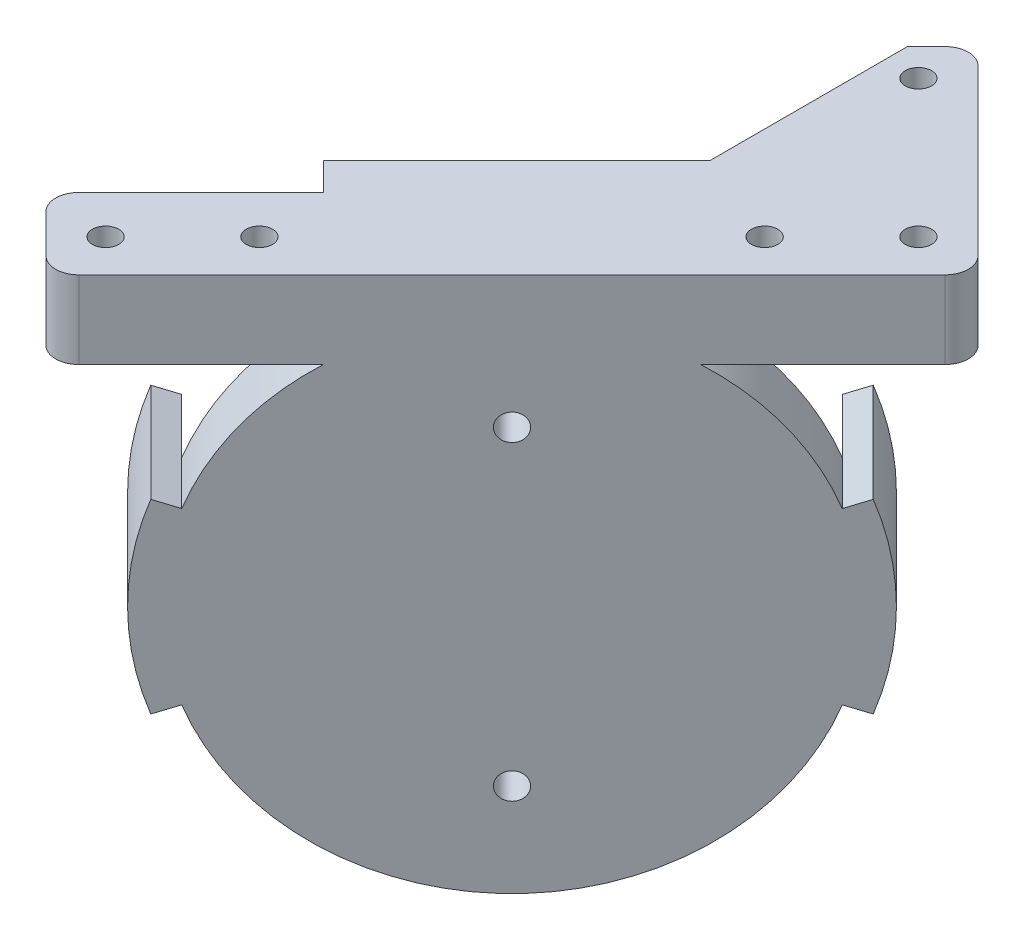
from build123d import *

# Parameters (mm, degrees)
SKETCH_1_R               = 1.25
EXTRUDE_1_DEPTH          = 3
SKETCH_2_R               = 1.5
CUT_EXTRUDE_1_DEPTH      = 3
CUT_EXTRUDE_2_DEPTH      = 3
CUT_EXTRUDE_3_DEPTH      = 3
CUT_EXTRUDE_4_DEPTH      = 10
SKETCH_6_R               = 1.5
CUT_EXTRUDE_5_DEPTH      = 10
SKETCH_7_R               = 1.5
CUT_EXTRUDE_8_DEPTH      = 10
SKETCH_8_R               = 1.5
CUT_EXTRUDE_9_DEPTH      = 10
SKETCH_9_R               = 15
CUT_EXTRUDE_10_DEPTH     = 10
SKETCH_11_R              = 1.5
EXTRUDE_3_DEPTH          = 3
CUT_EXTRUDE_12_DEPTH     = 3
EXTRUDE_4_DEPTH          = 3
SKETCH_15_R              = 15
EXTRUDE_5_DEPTH          = 3
CUT_EXTRUDE_13_DEPTH     = 3
EXTRUDE_START            = -3
EXTRUDE_7_DEPTH          = 3
CUT_EXTRUDE_14_DEPTH     = 3
CUT_EXTRUDE_15_DEPTH     = 3
PATTERN_CIRCULAR_1_COUNT = 8
SKETCH_22_R              = 1.25
CUT_EXTRUDE_17_DEPTH     = 3
SKETCH_23_R              = 1.5
CUT_EXTRUDE_18_DEPTH     = 10
SKETCH_24_R              = 1.5
CUT_EXTRUDE_19_DEPTH     = 10
CUT_EXTRUDE_START        = -10
SKETCH_25_R              = 60
CUT_EXTRUDE_20_DEPTH     = 10
EXTRUDE_8_DEPTH          = 3
EXTRUDE_10_DEPTH         = 3
SKETCH_28_R              = 1.54
SKETCH_28_R_2            = 1.52
SKETCH_28_R_3            = 1.5
CUT_EXTRUDE_21_DEPTH     = 3
SKETCH_29_R              = 1.5
CUT_EXTRUDE_22_DEPTH     = 3
EXTRUDE_11_DEPTH         = 3
SKETCH_31_R              = 1.5
CUT_EXTRUDE_23_DEPTH     = 3
EXTRUDE_12_DEPTH         = 3
CUT_EXTRUDE_24_DEPTH     = 3
EXTRUDE_13_DEPTH         = 3
CUT_EXTRUDE_25_DEPTH     = 10
CUT_EXTRUDE_26_DEPTH     = 10
EXTRUDE_14_DEPTH         = 3
SKETCH_38_R              = 6
CUT_EXTRUDE_28_DEPTH     = 3
SKETCH_39_R              = 1.5
CUT_EXTRUDE_29_DEPTH     = 3
CUT_EXTRUDE_30_DEPTH     = 10
SKETCH_41_R              = 1.7
EXTRUDE_15_DEPTH         = 10
SKETCH_42_W              = 84.852813742
SKETCH_42_H              = 3
CUT_EXTRUDE_31_DEPTH     = 48
CUT_EXTRUDE_33_DEPTH     = 10
SKETCH_45_R              = 1.7
EXTRUDE_16_DEPTH         = 8
CUT_EXTRUDE_START_2      = -19
SKETCH_46_R              = 1.7
CUT_EXTRUDE_34_DEPTH     = 19
FILLET_1_R               = 3
EXTRUDE_START_2          = 10
EXTRUDE_17_DEPTH         = 10


with BuildPart() as part:
    # 草图1 → 凸台-拉伸1 (new body)
    with BuildSketch(Plane(origin=(0, 0, 0), x_dir=(1, 0, 0), z_dir=(0, 1, 0))):
        with BuildLine():
            Line((-75, 15), (-75, -15))
            ThreePointArc((-75, -15), (-32.573593129, -32.573593129), (-15, -75))
            Line((-15, -75), (15, -75))
            ThreePointArc((15, -75), (32.573593129, -32.573593129), (75, -15))
            Line((75, -15), (75, 15))
            ThreePointArc((75, 15), (32.573593129, 32.573593129), (15, 75))
            Line((15, 75), (-15, 75))
            ThreePointArc((-15, 75), (-32.573593129, 32.573593129), (-75, 15))
        make_face()
        with Locations((-70, 11)):
            Circle(SKETCH_1_R, mode=Mode.SUBTRACT)
        with Locations((-11, 70)):
            Circle(SKETCH_1_R, mode=Mode.SUBTRACT)
        with Locations((-70, -11)):
            Circle(SKETCH_1_R, mode=Mode.SUBTRACT)
        with Locations((-11, -70)):
            Circle(SKETCH_1_R, mode=Mode.SUBTRACT)
        with Locations((11, 70)):
            Circle(SKETCH_1_R, mode=Mode.SUBTRACT)
        with Locations((70, 11)):
            Circle(SKETCH_1_R, mode=Mode.SUBTRACT)
        with Locations((70, -11)):
            Circle(SKETCH_1_R, mode=Mode.SUBTRACT)
        with Locations((11, -70)):
            Circle(SKETCH_1_R, mode=Mode.SUBTRACT)
    extrude(amount=EXTRUDE_1_DEPTH)

    # 草图2 → 切除-拉伸1 (cut)
    with BuildSketch(Plane.XZ):
        with Locations((0.353553391, -31.466251763)):
            Circle(SKETCH_2_R)
        with Locations((31.466251763, -0.353553391)):
            Circle(SKETCH_2_R)
        with Locations((-0.353553391, 31.466251763)):
            Circle(SKETCH_2_R)
        with Locations((-31.466251763, 0.353553391)):
            Circle(SKETCH_2_R)
    extrude(amount=-CUT_EXTRUDE_1_DEPTH, mode=Mode.SUBTRACT)

    # 草图3 → 切除-拉伸2 (cut)
    with BuildSketch(Plane(origin=(0, 3, 0), x_dir=(1, 0, 0), z_dir=(0, 1, 0))):
        Polygon((-12.02081528, 19.091883092), (-22.627416998, 22.627416998), (-19.091883092, 12.02081528), align=None)
    extrude(amount=-CUT_EXTRUDE_2_DEPTH, mode=Mode.SUBTRACT)

    # 草图4 → 切除-拉伸3 (cut)
    with BuildSketch(Plane(origin=(0, 3, 0), x_dir=(1, 0, 0), z_dir=(0, 1, 0))):
        with BuildLine():
            ThreePointArc((33.944668714, -19.80253309), (34.043922781, -8.582763971), (22.827665534, -8.285032838))
            Line((22.827665534, -8.285032838), (15.556349186, -15.556349186))
            Line((15.556349186, -15.556349186), (8.285032838, -22.827665534))
            ThreePointArc((8.285032838, -22.827665534), (8.582763971, -34.043922781), (19.80253309, -33.944668714))
            Line((19.80253309, -33.944668714), (33.944668714, -19.80253309))
        make_face()
    extrude(amount=-CUT_EXTRUDE_3_DEPTH, mode=Mode.SUBTRACT)

    # 草图5 → 切除-拉伸4 (cut)
    with BuildSketch(Plane(origin=(0, 3, 0), x_dir=(1, 0, 0), z_dir=(0, 1, 0))):
        Polygon((-22.627416998, 22.627416998), (-12.02081528, 19.091883092), (-8.485281374, 22.627416998), align=None)
        Polygon((-19.091883092, 12.02081528), (-22.627416998, 22.627416998), (-22.627416998, 8.485281374), align=None)
    extrude(amount=-CUT_EXTRUDE_4_DEPTH, mode=Mode.SUBTRACT)

    # 草图6 → 切除-拉伸5 (cut)
    with BuildSketch(Plane(origin=(0, 3, 0), x_dir=(1, 0, 0), z_dir=(0, 1, 0))):
        with Locations((-35.355339059, -21.213203436)):
            Circle(SKETCH_6_R)
        with Locations((-21.213203436, -35.355339059)):
            Circle(SKETCH_6_R)
        with Locations((35.355339059, 21.213203436)):
            Circle(SKETCH_6_R)
        with Locations((21.213203436, 35.355339059)):
            Circle(SKETCH_6_R)
    extrude(amount=-CUT_EXTRUDE_5_DEPTH, mode=Mode.SUBTRACT)

    # 草图7 → 切除-拉伸8 (cut)
    with BuildSketch(Plane(origin=(0, 3, 0), x_dir=(1, 0, 0), z_dir=(0, 1, 0))):
        with Locations((-29.69848481, 29.69848481)):
            Circle(SKETCH_7_R)
        with Locations((29.69848481, 29.69848481)):
            Circle(SKETCH_7_R)
        with Locations((29.69848481, -29.69848481)):
            Circle(SKETCH_7_R)
        with Locations((-29.69848481, -29.69848481)):
            Circle(SKETCH_7_R)
    extrude(amount=-CUT_EXTRUDE_8_DEPTH, mode=Mode.SUBTRACT)

    # 草图8 → 切除-拉伸9 (cut)
    with BuildSketch(Plane(origin=(0, 3, 0), x_dir=(1, 0, 0), z_dir=(0, 1, 0))):
        with Locations((-11, 55)):
            Circle(SKETCH_8_R)
        with Locations((11, 55)):
            Circle(SKETCH_8_R)
        with Locations((55, 11)):
            Circle(SKETCH_8_R)
        with Locations((55, -11)):
            Circle(SKETCH_8_R)
        with Locations((11, -55)):
            Circle(SKETCH_8_R)
        with Locations((-11, -55)):
            Circle(SKETCH_8_R)
        with Locations((-55, -11)):
            Circle(SKETCH_8_R)
        with Locations((-55, 11)):
            Circle(SKETCH_8_R)
    extrude(amount=-CUT_EXTRUDE_9_DEPTH, mode=Mode.SUBTRACT)

    # 草图9 → 切除-拉伸10 (cut)
    with BuildSketch(Plane(origin=(0, 3, 0), x_dir=(1, 0, 0), z_dir=(0, 1, 0))):
        Circle(SKETCH_9_R)
    extrude(amount=-CUT_EXTRUDE_10_DEPTH, mode=Mode.SUBTRACT)

    # 草图11 → 凸台-拉伸3 (add)
    with BuildSketch(Plane(origin=(0, 3, 0), x_dir=(1, 0, 0), z_dir=(0, 1, 0))):
        with Locations((-35.355339059, -21.213203436)):
            Circle(SKETCH_11_R)
        with Locations((35.355339059, 21.213203436)):
            Circle(SKETCH_11_R)
        with Locations((21.213203436, 35.355339059)):
            Circle(SKETCH_11_R)
        with Locations((0.353553391, 31.466251763)):
            Circle(SKETCH_11_R)
        with Locations((31.466251763, 0.353553391)):
            Circle(SKETCH_11_R)
        with Locations((-0.353553391, -31.466251763)):
            Circle(SKETCH_11_R)
        with Locations((-31.466251763, -0.353553391)):
            Circle(SKETCH_11_R)
        with Locations((-21.213203436, -35.355339059)):
            Circle(SKETCH_11_R)
    extrude(amount=-EXTRUDE_3_DEPTH)

    # 草图12 → 切除-拉伸12 (cut)
    with BuildSketch(Plane(origin=(0, 3, 0), x_dir=(1, 0, 0), z_dir=(0, 1, 0))):
        with BuildLine():
            Line((-44, 10), (-44, -10))
            ThreePointArc((-44, -10), (-40, -14), (-36, -10))
            Line((-36, -10), (-36, 0))
            Line((-36, 0), (-36, 10))
            ThreePointArc((-36, 10), (-40, 14), (-44, 10))
        make_face()
        with BuildLine():
            Line((10, 44), (-10, 44))
            ThreePointArc((-10, 44), (-14, 40), (-10, 36))
            Line((-10, 36), (10, 36))
            ThreePointArc((10, 36), (14, 40), (10, 44))
        make_face()
        with BuildLine():
            Line((44, -10), (44, 10))
            ThreePointArc((44, 10), (40, 14), (36, 10))
            Line((36, 10), (36, -10))
            ThreePointArc((36, -10), (40, -14), (44, -10))
        make_face()
        with BuildLine():
            Line((-10, -44), (10, -44))
            ThreePointArc((10, -44), (14, -40), (10, -36))
            Line((10, -36), (-10, -36))
            ThreePointArc((-10, -36), (-14, -40), (-10, -44))
        make_face()
    extrude(amount=-CUT_EXTRUDE_12_DEPTH, mode=Mode.SUBTRACT)

    # 草图14 → 凸台-拉伸4 (add)
    with BuildSketch(Plane(origin=(0, 3, 0), x_dir=(1, 0, 0), z_dir=(0, 1, 0))):
        with BuildLine():
            ThreePointArc((8.285032838, -22.827665534), (8.582763971, -34.043922781), (19.80253309, -33.944668714))
            Line((19.80253309, -33.944668714), (33.944668714, -19.80253309))
            ThreePointArc((33.944668714, -19.80253309), (34.043922781, -8.582763971), (22.827665534, -8.285032838))
            Line((22.827665534, -8.285032838), (8.285032838, -22.827665534))
        make_face()
    extrude(amount=-EXTRUDE_4_DEPTH)

    # 草图15 → 凸台-拉伸5 (add)
    with BuildSketch(Plane(origin=(0, 3, 0), x_dir=(1, 0, 0), z_dir=(0, 1, 0))):
        Circle(SKETCH_15_R)
    extrude(amount=-EXTRUDE_5_DEPTH)

    # 草图17 → 切除-拉伸13 (cut)
    with BuildSketch(Plane(origin=(0, 3, 0), x_dir=(1, 0, 0), z_dir=(0, 1, 0))):
        with BuildLine():
            Line((-2, -20), (-2, -10))
            ThreePointArc((-2, -10), (0, -8), (2, -10))
            Line((2, -10), (2, -20))
            ThreePointArc((2, -20), (0, -22), (-2, -20))
        make_face()
        with BuildLine():
            Line((-20, 2), (-10, 2))
            ThreePointArc((-10, 2), (-8, 0), (-10, -2))
            Line((-10, -2), (-20, -2))
            ThreePointArc((-20, -2), (-22, 0), (-20, 2))
        make_face()
        with BuildLine():
            Line((2, 20), (2, 10))
            ThreePointArc((2, 10), (0, 8), (-2, 10))
            Line((-2, 10), (-2, 20))
            ThreePointArc((-2, 20), (0, 22), (2, 20))
        make_face()
        with BuildLine():
            Line((20, -2), (10, -2))
            ThreePointArc((10, -2), (8, 0), (10, 2))
            Line((10, 2), (20, 2))
            ThreePointArc((20, 2), (22, 0), (20, -2))
        make_face()
    extrude(amount=-CUT_EXTRUDE_13_DEPTH, mode=Mode.SUBTRACT)

    # 草图18 → 凸台-拉伸7 (add)
    with BuildSketch(Plane(origin=(0, 3, 0), x_dir=(1, 0, 0), z_dir=(0, 1, 0)).offset(EXTRUDE_START)):
        with BuildLine():
            ThreePointArc((-45.952273324, 22.500194525), (-32.573593129, 32.573593129), (-22.500194525, 45.952273324))
            Line((-22.500194525, 45.952273324), (-38.525223259, 61.977302058))
            ThreePointArc((-38.525223259, 61.977302058), (-89.142135624, 89.142135624), (-61.977302058, 38.525223259))
            Line((-61.977302058, 38.525223259), (-45.952273324, 22.500194525))
        make_face()
    extrude(amount=EXTRUDE_7_DEPTH)

    # 草图19 → 切除-拉伸14 (cut)
    with BuildSketch(Plane(origin=(0, 3, 0), x_dir=(1, 0, 0), z_dir=(0, 1, 0))):
        with BuildLine():
            ThreePointArc((-37.140781925, 51.282917549), (-43.180194847, 43.180194847), (-51.282917549, 37.140781925))
            Line((-51.282917549, 37.140781925), (-43.975815885, 29.833680261))
            ThreePointArc((-43.975815885, 29.833680261), (-36.109127035, 36.109127035), (-29.833680261, 43.975815885))
            Line((-29.833680261, 43.975815885), (-37.140781925, 51.282917549))
        make_face()
    extrude(amount=-CUT_EXTRUDE_14_DEPTH, mode=Mode.SUBTRACT)

    # 草图21 → 切除-拉伸15 (cut)
    with BuildSketch(Plane(origin=(0, 3, 0), x_dir=(1, 0, 0), z_dir=(0, 1, 0))):
        with BuildLine():
            ThreePointArc((-59.9739809, 61.741747853), (-60.857864376, 62.107864376), (-61.741747853, 61.741747853))
            ThreePointArc((-61.741747853, 61.741747853), (-62.107864376, 60.857864376), (-61.741747853, 59.9739809))
            Line((-61.741747853, 59.9739809), (-54.670680041, 52.902913088))
            ThreePointArc((-54.670680041, 52.902913088), (-52.902913088, 52.902913088), (-52.902913088, 54.670680041))
            Line((-52.902913088, 54.670680041), (-59.9739809, 61.741747853))
        make_face()
        with BuildLine():
            ThreePointArc((-75.883883476, 74.116116524), (-75, 73.75), (-74.116116524, 74.116116524))
            ThreePointArc((-74.116116524, 74.116116524), (-73.75, 75), (-74.116116524, 75.883883476))
            Line((-74.116116524, 75.883883476), (-81.187184335, 82.954951288))
            ThreePointArc((-81.187184335, 82.954951288), (-82.954951288, 82.954951288), (-82.954951288, 81.187184335))
            Line((-82.954951288, 81.187184335), (-75.883883476, 74.116116524))
        make_face()
    cut_extrude_15 = extrude(amount=-CUT_EXTRUDE_15_DEPTH, mode=Mode.SUBTRACT)

    # 阵列(圆周)1: 切除-拉伸15 ×8 about axis
    pattern_circular_1_axis = Axis((-67.928932188, 3, -67.928932188), (0, 1, 0))
    for i in range(1, PATTERN_CIRCULAR_1_COUNT):
        add(cut_extrude_15.rotate(pattern_circular_1_axis, i * 360 / PATTERN_CIRCULAR_1_COUNT), mode=Mode.SUBTRACT)

    # 草图22 → 切除-拉伸17 (cut)
    with BuildSketch(Plane(origin=(0, 3, 0), x_dir=(1, 0, 0), z_dir=(0, 1, 0))):
        with Locations((9.899494937, 9.899494937)):
            Circle(SKETCH_22_R)
        with Locations((-9.899494937, -9.899494937)):
            Circle(SKETCH_22_R)
    extrude(amount=-CUT_EXTRUDE_17_DEPTH, mode=Mode.SUBTRACT)

    # 草图23 → 切除-拉伸18 (cut)
    with BuildSketch(Plane(origin=(0, 3, 0), x_dir=(1, 0, 0), z_dir=(0, 1, 0))):
        with Locations((0, 30)):
            Circle(SKETCH_23_R)
        with Locations((30, 0)):
            Circle(SKETCH_23_R)
        with Locations((0, -30)):
            Circle(SKETCH_23_R)
        with Locations((-30, 0)):
            Circle(SKETCH_23_R)
    extrude(amount=-CUT_EXTRUDE_18_DEPTH, mode=Mode.SUBTRACT)

    # 草图24 → 切除-拉伸19 (cut)
    with BuildSketch(Plane(origin=(0, 3, 0), x_dir=(1, 0, 0), z_dir=(0, 1, 0))):
        with Locations((-15, -15)):
            Circle(SKETCH_24_R)
        with Locations((15, 15)):
            Circle(SKETCH_24_R)
    extrude(amount=-CUT_EXTRUDE_19_DEPTH, mode=Mode.SUBTRACT)

    # 草图25 → 切除-拉伸20 (cut)
    with BuildSketch(Plane(origin=(0, 3, 0), x_dir=(1, 0, 0), z_dir=(0, 1, 0)).offset(CUT_EXTRUDE_START)):
        with Locations((-75, 75)):
            Circle(SKETCH_25_R)
    extrude(amount=CUT_EXTRUDE_20_DEPTH, mode=Mode.SUBTRACT)

    # 草图26 → 凸台-拉伸8 (add)
    with BuildSketch(Plane(origin=(0, 3, 0), x_dir=(1, 0, 0), z_dir=(0, 1, 0)).offset(EXTRUDE_START)):
        with BuildLine():
            ThreePointArc((-75, 15), (-32.573593129, 32.573593129), (-15, 75))
            Line((-15, 75), (-75, 15))
        make_face()
    extrude(amount=EXTRUDE_8_DEPTH)

    # 草图27 → 凸台-拉伸10 (add)
    with BuildSketch(Plane.XZ):
        Polygon((-75, -15), (-89.142135624, -29.142135624), (-29.142135624, -89.142135624), (-15, -75), align=None)
    extrude(amount=-EXTRUDE_10_DEPTH)

    # 草图28 → 切除-拉伸21 (cut)
    with BuildSketch(Plane.XZ):
        with Locations((-25.908116908, -78.234018716)):
            Circle(SKETCH_28_R)
        with Locations((-78.234018716, -25.908116908)):
            Circle(SKETCH_28_R_2)
        with Locations((11, -70)):
            Circle(SKETCH_28_R_3)
        with Locations((-11, -70)):
            Circle(SKETCH_28_R_3)
        with Locations((-70, -11)):
            Circle(SKETCH_28_R_3)
        with Locations((-70, 11)):
            Circle(SKETCH_28_R_3)
        with Locations((-11, 70)):
            Circle(SKETCH_28_R_3)
        with Locations((11, 70)):
            Circle(SKETCH_28_R_3)
        with Locations((70, 11)):
            Circle(SKETCH_28_R_3)
        with Locations((70, -11)):
            Circle(SKETCH_28_R_3)
    extrude(amount=-CUT_EXTRUDE_21_DEPTH, mode=Mode.SUBTRACT)

    # 草图29 → 切除-拉伸22 (cut)
    with BuildSketch(Plane.XZ):
        with Locations((-68.334523779, -35.807611845)):
            Circle(SKETCH_29_R)
        with Locations((-35.807611845, -68.334523779)):
            Circle(SKETCH_29_R)
    extrude(amount=-CUT_EXTRUDE_22_DEPTH, mode=Mode.SUBTRACT)

    # 草图30 → 凸台-拉伸11 (add)
    with BuildSketch(Plane.XZ):
        Polygon((-29.142135624, -89.142135624), (-89.142135624, -29.142135624), (-103.284271247, -43.284271247), (-43.284271247, -103.284271247), align=None)
    extrude(amount=-EXTRUDE_11_DEPTH)

    # 草图31 → 切除-拉伸23 (cut)
    with BuildSketch(Plane.XZ):
        with Locations((-43.585786438, -95.911688245)):
            Circle(SKETCH_31_R)
        with Locations((-53.485281374, -86.012193309)):
            Circle(SKETCH_31_R)
        with Locations((-86.012193309, -53.485281374)):
            Circle(SKETCH_31_R)
        with Locations((-95.911688245, -43.585786438)):
            Circle(SKETCH_31_R)
    extrude(amount=-CUT_EXTRUDE_23_DEPTH, mode=Mode.SUBTRACT)

    # 草图32 → 凸台-拉伸12 (add)
    with BuildSketch(Plane.XZ):
        with BuildLine():
            ThreePointArc((15, 75), (32.573593129, 32.573593129), (75, 15))
            Line((75, 15), (89.142135624, 29.142135624))
            Line((89.142135624, 29.142135624), (29.142135624, 89.142135624))
            Line((29.142135624, 89.142135624), (15, 75))
        make_face()
    extrude(amount=-EXTRUDE_12_DEPTH)

    # 草图33 → 切除-拉伸24 (cut)
    with BuildSketch(Plane(origin=(0, 0, 0), x_dir=(-1, 0, 0), z_dir=(0, -1, 0))):
        with BuildLine():
            Line((-29.554853575, -42.91995823), (-19.554853575, -42.91995823))
            ThreePointArc((-19.554853575, -42.91995823), (-18.054501588, -44.420310217), (-19.554853575, -45.920662203))
            Line((-19.554853575, -45.920662203), (-29.554853575, -45.920662203))
            ThreePointArc((-29.554853575, -45.920662203), (-31.055205561, -44.420310217), (-29.554853575, -42.91995823))
        make_face()
        with BuildLine():
            Line((-42.91995823, -59.285766859), (-42.91995823, -69.285766859))
            ThreePointArc((-42.91995823, -69.285766859), (-44.420310217, -70.786118845), (-45.920662203, -69.285766859))
            Line((-45.920662203, -69.285766859), (-45.920662203, -59.285766859))
            ThreePointArc((-45.920662203, -59.285766859), (-44.420310217, -57.785414872), (-42.91995823, -59.285766859))
        make_face()
        with BuildLine():
            Line((-59.285766859, -45.920662203), (-69.285766859, -45.920662203))
            ThreePointArc((-69.285766859, -45.920662203), (-70.786118845, -44.420310217), (-69.285766859, -42.91995823))
            Line((-69.285766859, -42.91995823), (-59.285766859, -42.91995823))
            ThreePointArc((-59.285766859, -42.91995823), (-57.785414872, -44.420310217), (-59.285766859, -45.920662203))
        make_face()
        with BuildLine():
            Line((-45.920662203, -29.554853575), (-45.920662203, -19.554853575))
            ThreePointArc((-45.920662203, -19.554853575), (-44.420310217, -18.054501588), (-42.91995823, -19.554853575))
            Line((-42.91995823, -19.554853575), (-42.91995823, -29.554853575))
            ThreePointArc((-42.91995823, -29.554853575), (-44.420310217, -31.055205561), (-45.920662203, -29.554853575))
        make_face()
    extrude(amount=-CUT_EXTRUDE_24_DEPTH, mode=Mode.SUBTRACT)

    # 草图34 → 凸台-拉伸13 (add)
    with BuildSketch(Plane.XZ):
        Polygon((29.142135624, 89.142135624), (89.142135624, 29.142135624), (103.284271247, 43.284271247), (43.284271247, 103.284271247), align=None)
    extrude(amount=-EXTRUDE_13_DEPTH)

    # 草图35 → 切除-拉伸25 (cut)
    with BuildSketch(Plane.XZ.offset(CUT_EXTRUDE_START)):
        with BuildLine():
            Line((18.485281374, 37.171572875), (12.828427125, 42.828427125))
            ThreePointArc((12.828427125, 42.828427125), (7.171572875, 42.828427125), (7.171572875, 37.171572875))
            Line((7.171572875, 37.171572875), (12.828427125, 31.514718626))
            ThreePointArc((12.828427125, 31.514718626), (18.485281374, 31.514718626), (18.485281374, 37.171572875))
        make_face()
        with BuildLine():
            Line((-12.828427125, 31.514718626), (-7.171572875, 37.171572875))
            ThreePointArc((-7.171572875, 37.171572875), (-7.171572875, 42.828427125), (-12.828427125, 42.828427125))
            Line((-12.828427125, 42.828427125), (-18.485281374, 37.171572875))
            ThreePointArc((-18.485281374, 37.171572875), (-18.485281374, 31.514718626), (-12.828427125, 31.514718626))
        make_face()
        with BuildLine():
            Line((37.171572875, -18.485281374), (42.828427125, -12.828427125))
            ThreePointArc((42.828427125, -12.828427125), (42.828427125, -7.171572875), (37.171572875, -7.171572875))
            Line((37.171572875, -7.171572875), (31.514718626, -12.828427125))
            ThreePointArc((31.514718626, -12.828427125), (31.514718626, -18.485281374), (37.171572875, -18.485281374))
        make_face()
        with BuildLine():
            Line((31.514718626, 12.828427125), (37.171572875, 7.171572875))
            ThreePointArc((37.171572875, 7.171572875), (42.828427125, 7.171572875), (42.828427125, 12.828427125))
            Line((42.828427125, 12.828427125), (37.171572875, 18.485281374))
            ThreePointArc((37.171572875, 18.485281374), (31.514718626, 18.485281374), (31.514718626, 12.828427125))
        make_face()
        with BuildLine():
            Line((-18.485281374, -37.171572875), (-12.828427125, -42.828427125))
            ThreePointArc((-12.828427125, -42.828427125), (-7.171572875, -42.828427125), (-7.171572875, -37.171572875))
            Line((-7.171572875, -37.171572875), (-12.828427125, -31.514718626))
            ThreePointArc((-12.828427125, -31.514718626), (-18.485281374, -31.514718626), (-18.485281374, -37.171572875))
        make_face()
        with BuildLine():
            Line((12.828427125, -31.514718626), (7.171572875, -37.171572875))
            ThreePointArc((7.171572875, -37.171572875), (7.171572875, -42.828427125), (12.828427125, -42.828427125))
            Line((12.828427125, -42.828427125), (18.485281374, -37.171572875))
            ThreePointArc((18.485281374, -37.171572875), (18.485281374, -31.514718626), (12.828427125, -31.514718626))
        make_face()
        with BuildLine():
            Line((-37.171572875, 18.485281374), (-42.828427125, 12.828427125))
            ThreePointArc((-42.828427125, 12.828427125), (-42.828427125, 7.171572875), (-37.171572875, 7.171572875))
            Line((-37.171572875, 7.171572875), (-31.514718626, 12.828427125))
            ThreePointArc((-31.514718626, 12.828427125), (-31.514718626, 18.485281374), (-37.171572875, 18.485281374))
        make_face()
        with BuildLine():
            Line((-31.514718626, -12.828427125), (-37.171572875, -7.171572875))
            ThreePointArc((-37.171572875, -7.171572875), (-42.828427125, -7.171572875), (-42.828427125, -12.828427125))
            Line((-42.828427125, -12.828427125), (-37.171572875, -18.485281374))
            ThreePointArc((-37.171572875, -18.485281374), (-31.514718626, -18.485281374), (-31.514718626, -12.828427125))
        make_face()
    extrude(amount=CUT_EXTRUDE_25_DEPTH, mode=Mode.SUBTRACT)

    # 草图36 → 切除-拉伸26 (cut)
    with BuildSketch(Plane.XZ):
        with BuildLine():
            Line((19.554853575, 45.920310217), (29.554853575, 45.920310217))
            ThreePointArc((29.554853575, 45.920310217), (31.054853575, 44.420310217), (29.554853575, 42.920310217))
            Line((29.554853575, 42.920310217), (19.554853575, 42.920310217))
            ThreePointArc((19.554853575, 42.920310217), (18.054853575, 44.420310217), (19.554853575, 45.920310217))
        make_face()
        with BuildLine():
            Line((45.920310217, 69.285766859), (45.920310217, 59.285766859))
            ThreePointArc((45.920310217, 59.285766859), (44.420310217, 57.785766859), (42.920310217, 59.285766859))
            Line((42.920310217, 59.285766859), (42.920310217, 69.285766859))
            ThreePointArc((42.920310217, 69.285766859), (44.420310217, 70.785766859), (45.920310217, 69.285766859))
        make_face()
        with BuildLine():
            Line((69.285766859, 42.920310217), (59.285766859, 42.920310217))
            ThreePointArc((59.285766859, 42.920310217), (57.785766859, 44.420310217), (59.285766859, 45.920310217))
            Line((59.285766859, 45.920310217), (69.285766859, 45.920310217))
            ThreePointArc((69.285766859, 45.920310217), (70.785766859, 44.420310217), (69.285766859, 42.920310217))
        make_face()
        with BuildLine():
            Line((42.920310217, 19.554853575), (42.920310217, 29.554853575))
            ThreePointArc((42.920310217, 29.554853575), (44.420310217, 31.054853575), (45.920310217, 29.554853575))
            Line((45.920310217, 29.554853575), (45.920310217, 19.554853575))
            ThreePointArc((45.920310217, 19.554853575), (44.420310217, 18.054853575), (42.920310217, 19.554853575))
        make_face()
        with BuildLine():
            Line((26.625921387, 52.991378029), (36.625921387, 52.991378029))
            ThreePointArc((36.625921387, 52.991378029), (38.125921387, 51.491378029), (36.625921387, 49.991378029))
            Line((36.625921387, 49.991378029), (26.625921387, 49.991378029))
            ThreePointArc((26.625921387, 49.991378029), (25.125921387, 51.491378029), (26.625921387, 52.991378029))
        make_face()
        with BuildLine():
            Line((52.991378029, 76.356834671), (52.991378029, 66.356834671))
            ThreePointArc((52.991378029, 66.356834671), (51.491378029, 64.856834671), (49.991378029, 66.356834671))
            Line((49.991378029, 66.356834671), (49.991378029, 76.356834671))
            ThreePointArc((49.991378029, 76.356834671), (51.491378029, 77.856834671), (52.991378029, 76.356834671))
        make_face()
        with BuildLine():
            Line((76.356834671, 49.991378029), (66.356834671, 49.991378029))
            ThreePointArc((66.356834671, 49.991378029), (64.856834671, 51.491378029), (66.356834671, 52.991378029))
            Line((66.356834671, 52.991378029), (76.356834671, 52.991378029))
            ThreePointArc((76.356834671, 52.991378029), (77.856834671, 51.491378029), (76.356834671, 49.991378029))
        make_face()
        with BuildLine():
            Line((49.991378029, 26.625921387), (49.991378029, 36.625921387))
            ThreePointArc((49.991378029, 36.625921387), (51.491378029, 38.125921387), (52.991378029, 36.625921387))
            Line((52.991378029, 36.625921387), (52.991378029, 26.625921387))
            ThreePointArc((52.991378029, 26.625921387), (51.491378029, 25.125921387), (49.991378029, 26.625921387))
        make_face()
    extrude(amount=-CUT_EXTRUDE_26_DEPTH, mode=Mode.SUBTRACT)

    # 草图37 → 凸台-拉伸14 (add)
    with BuildSketch(Plane.XZ):
        with BuildLine():
            Line((47.887960234, 69.285766859), (47.887960234, 59.853486281))
            ThreePointArc((47.887960234, 59.853486281), (44.420310217, 56.385836264), (40.9526602, 59.853486281))
            Line((40.9526602, 59.853486281), (40.9526602, 69.285766859))
            ThreePointArc((40.9526602, 69.285766859), (44.420310217, 72.753416876), (47.887960234, 69.285766859))
        make_face()
        with BuildLine():
            Line((60.034978693, 48.181382834), (68.503147508, 48.181382834))
            ThreePointArc((68.503147508, 48.181382834), (71.914895036, 44.769635306), (68.503147508, 41.357887778))
            Line((68.503147508, 41.357887778), (60.034978693, 41.357887778))
            ThreePointArc((60.034978693, 41.357887778), (56.623231165, 44.769635306), (60.034978693, 48.181382834))
        make_face()
        with BuildLine():
            Line((48.512210879, 29.554853575), (48.512210879, 19.628947818))
            ThreePointArc((48.512210879, 19.628947818), (44.420310217, 15.537047156), (40.328409554, 19.628947818))
            Line((40.328409554, 19.628947818), (40.328409554, 29.554853575))
            ThreePointArc((40.328409554, 29.554853575), (44.420310217, 33.646754237), (48.512210879, 29.554853575))
        make_face()
        with BuildLine():
            Line((20.324066568, 48.08525583), (29.519488245, 48.08525583))
            ThreePointArc((29.519488245, 48.08525583), (32.835108769, 44.769635306), (29.519488245, 41.454014782))
            Line((29.519488245, 41.454014782), (20.324066568, 41.454014782))
            ThreePointArc((20.324066568, 41.454014782), (17.008446044, 44.769635306), (20.324066568, 48.08525583))
        make_face()
    extrude(amount=-EXTRUDE_14_DEPTH)

    # 草图38 → 切除-拉伸28 (cut)
    with BuildSketch(Plane.XZ):
        with Locations((51.491378029, 51.491378029)):
            Circle(SKETCH_38_R)
        with Locations((-58.110173055, -58.110173055)):
            Circle(SKETCH_38_R)
        Polygon((-52.453318806, -52.453318806), (-53.867532368, -51.039105243), (-51.039105243, -51.039105243), (-51.039105243, -53.867532368), align=None)
        Polygon((57.148232278, 57.148232278), (55.734018716, 58.562445841), (58.562445841, 58.562445841), (58.562445841, 55.734018716), align=None)
        Polygon((59.491378029, 53.491378029), (61.491378029, 51.491378029), (59.491378029, 49.491378029), (59.491378029, 51.491378029), align=None)
        Polygon((58.562445841, 47.248737342), (58.562445841, 44.420310217), (55.734018716, 44.420310217), (57.148232278, 45.834523779), align=None)
        Polygon((53.491378029, 43.491378029), (51.491378029, 41.491378029), (49.491378029, 43.491378029), (51.491378029, 43.491378029), align=None)
        Polygon((47.248737342, 44.420310217), (44.420310217, 44.420310217), (44.420310217, 47.248737342), (45.834523779, 45.834523779), align=None)
        Polygon((43.491378029, 49.491378029), (41.491378029, 51.491378029), (43.491378029, 53.491378029), (43.491378029, 51.491378029), align=None)
        Polygon((44.420310217, 55.734018716), (44.420310217, 58.562445841), (47.248737342, 58.562445841), (45.834523779, 57.148232278), align=None)
        Polygon((49.491378029, 59.491378029), (51.491378029, 61.491378029), (53.491378029, 59.491378029), (51.491378029, 59.491378029), align=None)
        Polygon((-50.110173055, -56.110173055), (-48.110173055, -58.110173055), (-50.110173055, -60.110173055), (-50.110173055, -58.110173055), align=None)
        Polygon((-51.039105243, -62.352813742), (-51.039105243, -65.181240867), (-53.867532368, -65.181240867), (-52.453318806, -63.767027305), align=None)
        Polygon((-56.110173055, -66.110173055), (-58.110173055, -68.110173055), (-60.110173055, -66.110173055), (-58.110173055, -66.110173055), align=None)
        Polygon((-62.352813742, -65.181240867), (-65.181240867, -65.181240867), (-65.181240867, -62.352813742), (-63.767027305, -63.767027305), align=None)
        Polygon((-66.110173055, -60.110173055), (-68.110173055, -58.110173055), (-66.110173055, -56.110173055), (-66.110173055, -58.110173055), align=None)
        Polygon((-65.181240867, -53.867532368), (-65.181240867, -51.039105243), (-62.352813742, -51.039105243), (-63.767027305, -52.453318806), align=None)
        Polygon((-60.110173055, -50.110173055), (-58.110173055, -48.110173055), (-56.110173055, -50.110173055), (-58.110173055, -50.110173055), align=None)
    extrude(amount=-CUT_EXTRUDE_28_DEPTH, mode=Mode.SUBTRACT)

    # 草图39 → 切除-拉伸29 (cut)
    with BuildSketch(Plane.XZ):
        with Locations((-69.748737342, -69.748737342)):
            Circle(SKETCH_39_R)
        with Locations((-73.991378029, -65.506096654)):
            Circle(SKETCH_39_R)
        with Locations((-78.234018716, -61.263455967)):
            Circle(SKETCH_39_R)
        with Locations((-82.476659403, -57.02081528)):
            Circle(SKETCH_39_R)
        with Locations((-65.506096654, -73.991378029)):
            Circle(SKETCH_39_R)
        with Locations((-61.263455967, -78.234018716)):
            Circle(SKETCH_39_R)
        with Locations((-57.02081528, -82.476659403)):
            Circle(SKETCH_39_R)
    extrude(amount=-CUT_EXTRUDE_29_DEPTH, mode=Mode.SUBTRACT)

    # 草图40 → 切除-拉伸30 (cut)
    with BuildSketch(Plane.XZ):
        Polygon((151.706406627, 9.348320998), (25.381498024, 135.673229601), (-100.145865789, 10.145865789), (26.179042814, -116.179042814), align=None)
    extrude(amount=-CUT_EXTRUDE_30_DEPTH, mode=Mode.SUBTRACT)

    # 草图41 → 凸台-拉伸15 (add)
    with BuildSketch(Plane(origin=(0, 0, 0), x_dir=(-1, 0, 0), z_dir=(0, -1, 0))):
        with BuildLine():
            Line((101.162950904, 41.162950904), (79.949747468, 19.949747468))
            ThreePointArc((79.949747468, 19.949747468), (77.828427125, 19.071067812), (75.707106781, 19.949747468))
            Line((75.707106781, 19.949747468), (19.949747468, 75.707106781))
            ThreePointArc((19.949747468, 75.707106781), (19.071067812, 77.828427125), (19.949747468, 79.949747468))
            Line((19.949747468, 79.949747468), (41.162950904, 101.162950904))
            ThreePointArc((41.162950904, 101.162950904), (43.284271247, 102.04163056), (45.405591591, 101.162950904))
            Line((45.405591591, 101.162950904), (47.828427125, 98.74011537))
            Line((47.828427125, 98.74011537), (47.828427125, 73.284271247))
            Line((47.828427125, 73.284271247), (73.284271247, 47.828427125))
            Line((73.284271247, 47.828427125), (98.74011537, 47.828427125))
            Line((98.74011537, 47.828427125), (101.162950904, 45.405591591))
            ThreePointArc((101.162950904, 45.405591591), (102.04163056, 43.284271247), (101.162950904, 41.162950904))
        make_face()
        with Locations((68.334523779, 35.807611845)):
            Circle(SKETCH_41_R, mode=Mode.SUBTRACT)
        with Locations((78.234018716, 25.908116908)):
            Circle(SKETCH_41_R, mode=Mode.SUBTRACT)
        with Locations((95.911688245, 43.585786438)):
            Circle(SKETCH_41_R, mode=Mode.SUBTRACT)
        with Locations((43.585786438, 95.911688245)):
            Circle(SKETCH_41_R, mode=Mode.SUBTRACT)
        with Locations((25.908116908, 78.234018716)):
            Circle(SKETCH_41_R, mode=Mode.SUBTRACT)
        with Locations((35.807611845, 68.334523779)):
            Circle(SKETCH_41_R, mode=Mode.SUBTRACT)
    extrude(amount=EXTRUDE_15_DEPTH)

    # 草图42 → 切除-拉伸31 (cut)
    with BuildSketch(Plane(origin=(-73.284271247, 0, -73.284271247), x_dir=(-0.7071067811865477, 0, 0.7071067811865475), z_dir=(-0.7071067811865475, 0, -0.7071067811865477))):
        with Locations((0, 1.5)):
            Rectangle(SKETCH_42_W, SKETCH_42_H)
    extrude(amount=-CUT_EXTRUDE_31_DEPTH, mode=Mode.SUBTRACT)

    # 草图44 → 切除-拉伸33 (cut)
    with BuildSketch(Plane(origin=(-60.556349186, 0, -60.556349186), x_dir=(-0.7071067811865475, 0, 0.7071067811865477), z_dir=(-0.7071067811865477, 0, -0.7071067811865475))):
        with BuildLine():
            Line((-17.175564037, -10), (17.175564037, -10))
            ThreePointArc((17.175564037, -10), (0, -5), (-17.175564037, -10))
        make_face()
    extrude(amount=-CUT_EXTRUDE_33_DEPTH, mode=Mode.SUBTRACT)

    # 草图45 → 凸台-拉伸16 (add)
    with BuildSketch(Plane(origin=(-53.485281374, 0, -53.485281374), x_dir=(-0.7071067811865476, 0, 0.7071067811865476), z_dir=(-0.7071067811865476, 0, -0.7071067811865476))):
        with BuildLine():
            Line((-32.889241728, -48.970705016), (-30.070163865, -47.944644586))
            ThreePointArc((-30.070163865, -47.944644586), (0, -69), (30.070163865, -47.944644586))
            Line((30.070163865, -47.944644586), (32.889241728, -48.970705016))
            ThreePointArc((32.889241728, -48.970705016), (35, -37), (32.889241728, -25.029294984))
            Line((32.889241728, -25.029294984), (30.070163865, -26.055355414))
            ThreePointArc((30.070163865, -26.055355414), (24.94961544, -16.96211864), (17.175564037, -10))
            Line((17.175564037, -10), (-17.175564037, -10))
            ThreePointArc((-17.175564037, -10), (-24.94961544, -16.96211864), (-30.070163865, -26.055355414))
            Line((-30.070163865, -26.055355414), (-32.889241728, -25.029294984))
            ThreePointArc((-32.889241728, -25.029294984), (-35, -37), (-32.889241728, -48.970705016))
        make_face()
        with Locations((0, -57)):
            Circle(SKETCH_45_R, mode=Mode.SUBTRACT)
        with Locations((0, -17)):
            Circle(SKETCH_45_R, mode=Mode.SUBTRACT)
    extrude(amount=-EXTRUDE_16_DEPTH)

    # 草图46 → 切除-拉伸34 (cut)
    with BuildSketch(Plane.XZ.offset(10).offset(CUT_EXTRUDE_START_2)):
        with BuildLine():
            Line((-72.701306988, -48.411391385), (-69.165773082, -44.875857479))
            Line((-69.165773082, -44.875857479), (-87.02081528, -27.02081528))
            Line((-87.02081528, -27.02081528), (-101.162950904, -41.162950904))
            ThreePointArc((-101.162950904, -41.162950904), (-102.04163056, -43.284271247), (-101.162950904, -45.405591591))
            Line((-101.162950904, -45.405591591), (-98.74011537, -47.828427125))
            Line((-98.74011537, -47.828427125), (-73.284271247, -47.828427125))
            Line((-73.284271247, -47.828427125), (-72.701306988, -48.411391385))
        make_face()
        with Locations((-95.911688245, -43.585786438)):
            Circle(SKETCH_46_R, mode=Mode.SUBTRACT)
    extrude(amount=CUT_EXTRUDE_34_DEPTH, mode=Mode.SUBTRACT)

    # 圆角1
    fillet_1_edges = [part.edges().sort_by_distance(p)[0] for p in [
        (-87.02081528, -5, -27.02081528),
    ]]
    fillet(fillet_1_edges, radius=FILLET_1_R)

    # 草图48 → 凸台-拉伸17 (add)
    with BuildSketch(Plane(origin=(-53.485281374, 0, -53.485281374), x_dir=(-0.7071067811865476, 0, 0.7071067811865476), z_dir=(-0.7071067811865476, 0, -0.7071067811865476)).offset(EXTRUDE_START_2)):
        with BuildLine():
            Line((-30.070163865, -26.055355414), (-32.889241728, -25.029294984))
            ThreePointArc((-32.889241728, -25.029294984), (-35, -37), (-32.889241728, -48.970705016))
            Line((-32.889241728, -48.970705016), (-30.070163865, -47.944644586))
            ThreePointArc((-30.070163865, -47.944644586), (-32, -37), (-30.070163865, -26.055355414))
        make_face()
        with BuildLine():
            ThreePointArc((32.889241728, -48.970705016), (35, -37), (32.889241728, -25.029294984))
            Line((32.889241728, -25.029294984), (30.070163865, -26.055355414))
            ThreePointArc((30.070163865, -26.055355414), (32, -37), (30.070163865, -47.944644586))
            Line((30.070163865, -47.944644586), (32.889241728, -48.970705016))
        make_face()
    extrude(amount=-EXTRUDE_17_DEPTH)


solid = part.part
